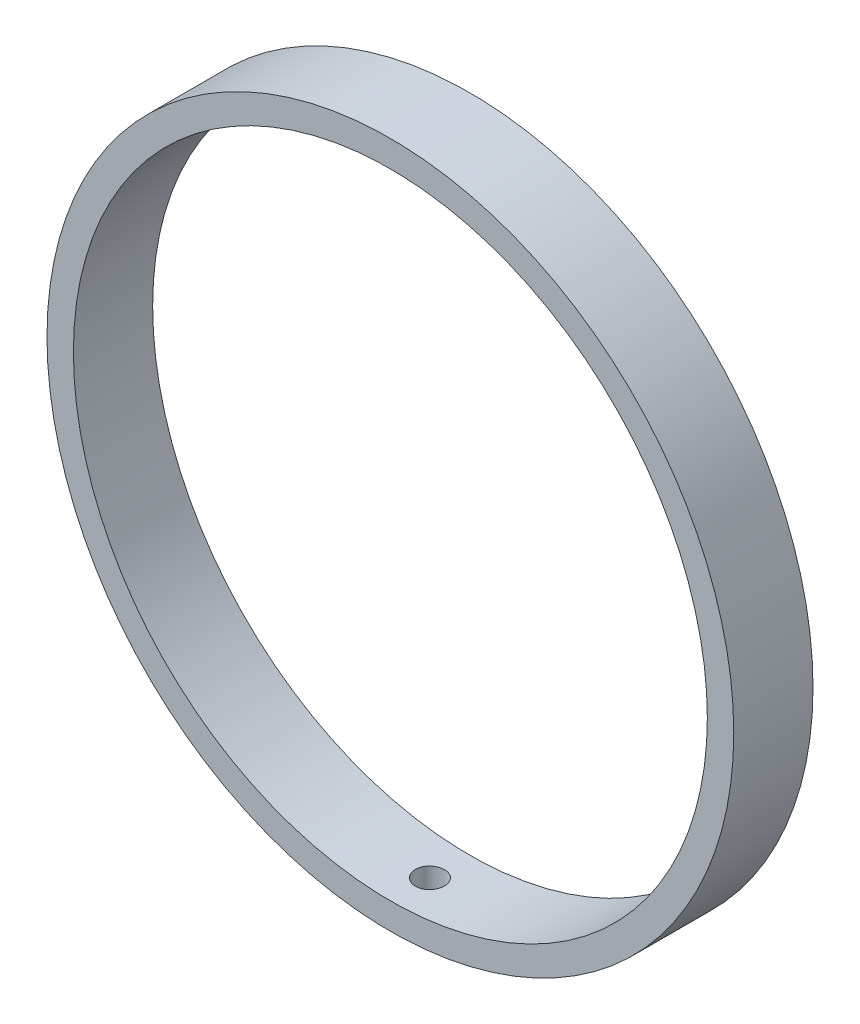
from build123d import *

# Parameters (mm, degrees)
SKETCH1_R           = 82.55
SKETCH1_R_2         = 76.2
BOSS_EXTRUDE1_DEPTH = 19.05
SKETCH2_R           = 3.478244762
CUT_EXTRUDE1_DEPTH  = 119.287393665


with BuildPart() as part:
    # Sketch1 → Boss-Extrude1 (new body)
    with BuildSketch(Plane.XY):
        Circle(SKETCH1_R)
        Circle(SKETCH1_R_2, mode=Mode.SUBTRACT)
    extrude(amount=BOSS_EXTRUDE1_DEPTH)

    # Sketch2 → Cut-Extrude1 (cut, through all)
    with BuildSketch(Plane(origin=(0, 0, 0), x_dir=(1, 0, 0), z_dir=(0, 1, 0))):
        with Locations((0, -9.525)):
            Circle(SKETCH2_R)
    extrude(amount=-CUT_EXTRUDE1_DEPTH, mode=Mode.SUBTRACT)


solid = part.part
